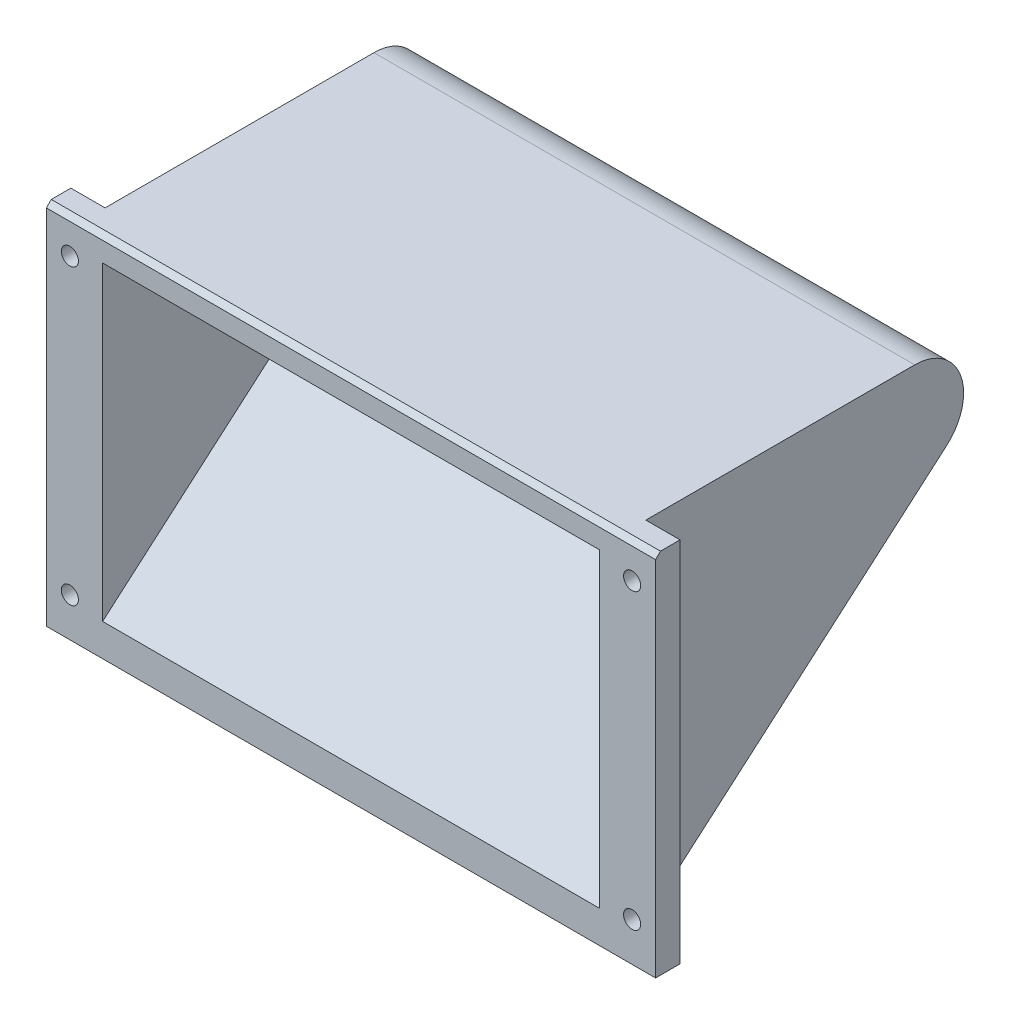
from build123d import *

# Parameters (mm, degrees)
BOSS_EXTRUDE1_DEPTH = 50.8
BOSS_EXTRUDE3_START = 4.5
BOSS_EXTRUDE3_DEPTH = 4.5
BOSS_EXTRUDE4_DEPTH = 5
SKETCH6_R           = 1.75
CUT_EXTRUDE1_DEPTH  = 18.75
CHAMFER1_SIZE       = 1


with BuildPart() as part:
    # Sketch1 → Boss-Extrude1 (new, symmetric)
    with BuildSketch(Plane(origin=(0, 0, 0), x_dir=(0, 0, -1), z_dir=(1, 0, 0))):
        with BuildLine():
            Line((0, 0), (60, 0))
            ThreePointArc((60, 0), (64.685586675, -3.254927648), (63.270675103, -8.781888995))
            Line((63.270675103, -8.781888995), (0, -63.5))
            Line((0, -63.5), (0, -70.110453145))
            Line((0, -70.110453145), (66.541350207, -12.56377799))
            ThreePointArc((66.541350207, -12.56377799), (69.37117335, -1.509855296), (60, 5))
            Line((60, 5), (0, 5))
            Line((0, 5), (0, 0))
        make_face()
    extrude(amount=BOSS_EXTRUDE1_DEPTH, both=True)

    # Sketch3 → Boss-Extrude3 (add)
    with BuildSketch(Plane(origin=(50.8, 0, 0), x_dir=(0, 0, -1), z_dir=(1, 0, 0)).offset(BOSS_EXTRUDE3_START)):
        with BuildLine():
            Line((0, -70.110453145), (66.541350207, -12.56377799))
            ThreePointArc((66.541350207, -12.56377799), (69.37117335, -1.509855296), (60, 5))
            Line((60, 5), (0, 5))
            Line((0, 5), (0, -70.110453145))
        make_face()
    boss_extrude3 = extrude(amount=-BOSS_EXTRUDE3_DEPTH)

    # Mirror1: Boss-Extrude3 across plane
    add(boss_extrude3.mirror(Plane(origin=(0, 0, 0), x_dir=(0, 0, 1), z_dir=(1, 0, 0))))

    # Sketch4 → Boss-Extrude4 (add)
    with BuildSketch(Plane.XY):
        Polygon((-50.8, 5), (-62.3, 5), (-62.3, -70.110453145), (62.3, -70.110453145), (62.3, 5), (50.8, 5), (50.8, -63.5), (-50.8, -63.5), align=None)
    extrude(amount=-BOSS_EXTRUDE4_DEPTH)

    # Sketch6 → Cut-Extrude1 (cut)
    with BuildSketch(Plane.XY):
        with Locations((-57.5, -2.146)):
            Circle(SKETCH6_R)
        with Locations((-57.5, -62.146)):
            Circle(SKETCH6_R)
        with Locations((57.5, -62.146)):
            Circle(SKETCH6_R)
        with Locations((57.5, -2.146)):
            Circle(SKETCH6_R)
    extrude(amount=-CUT_EXTRUDE1_DEPTH, mode=Mode.SUBTRACT)

    # Chamfer1
    chamfer1_edges = [part.edges().sort_by_distance(p)[0] for p in [
        (0, 5, 0),
    ]]
    chamfer(chamfer1_edges, length=CHAMFER1_SIZE)


solid = part.part
